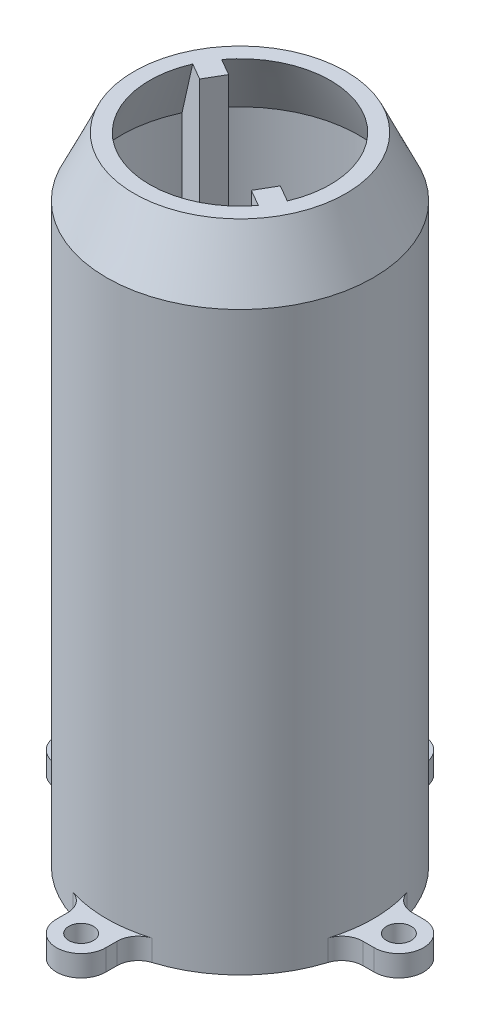
from build123d import *
from build123d.topology import SkipClean

# Parameters (mm, degrees)
SKETCH2_R           = 1.75
CUT_EXTRUDE1_DEPTH  = 10
SKETCH4_R           = 36.837485066
SKETCH4_R_2         = 31.9
CUT_EXTRUDE2_DEPTH  = 99.001122443
FILLET1_R           = 3
BOSS_EXTRUDE1_REACH = 99.221


with BuildPart() as part:
    # Sketch1 → Revolve1 (revolve)
    with BuildSketch(Plane(origin=(0, 0, 0), x_dir=(0, 0, -1), z_dir=(1, 0, 0)), mode=Mode.PRIVATE) as revolve1_sk:
        Polygon((-12.793244162, 90), (-15, 90), (-18.9, 81.63642301), (-18.9, 3), (-31.9, 3), (-31.9, 0), (-17.6, 0), (-16.9, 0), (-16.9, 81.193033685), align=None)
    revolve(revolve1_sk.sketch.rotate(Axis((0, -1110.96911415, 0), (0, 1, 0)), 180), axis=Axis((0, -1110.96911415, 0), (0, 1, 0)))

    # Sketch2 → Cut-Extrude1 (cut)
    with BuildSketch(Plane.XZ):
        with Locations(Location((0, 22.5, 0), (0, 0, 270))):
            Circle(SKETCH2_R)
        with Locations(Location((0, -22.5, 0), (0, 0, 270))):
            Circle(SKETCH2_R)
        with Locations(Location((-22.5, 0, 0), (0, 0, 270))):
            Circle(SKETCH2_R)
        with Locations(Location((22.5, 0, 0), (0, 0, 270))):
            Circle(SKETCH2_R)
    extrude(amount=-CUT_EXTRUDE1_DEPTH, mode=Mode.SUBTRACT)

    # Sketch4 → Cut-Extrude2 (cut, through all)
    # profile 1 of 2: a face of its own
    with SkipClean():  # the faces are left unmerged after this step: merging them gives an invalid solid
        with BuildSketch(Plane(origin=(0, 3, 0), x_dir=(1, 0, 0), z_dir=(0, 1, 0))):
            Circle(SKETCH4_R)
            Circle(SKETCH4_R_2, mode=Mode.SUBTRACT)
        # profile 2 of 2: a face of its own
        with BuildSketch(Plane(origin=(0, 3, 0), x_dir=(1, 0, 0), z_dir=(0, 1, 0))):
            Circle(SKETCH4_R_2)
            with BuildLine():
                Line((-3.5, 18.573098826), (-3.5, 22.5))
                ThreePointArc((-3.5, 22.5), (0, 26), (3.5, 22.5))
                Line((3.5, 22.5), (3.5, 18.573098826))
                ThreePointArc((3.5, 18.573098826), (13.364318164, 13.364318164), (18.573098826, 3.5))
                Line((18.573098826, 3.5), (22.5, 3.5))
                ThreePointArc((22.5, 3.5), (26, 0), (22.5, -3.5))
                Line((22.5, -3.5), (18.573098826, -3.5))
                ThreePointArc((18.573098826, -3.5), (13.364318164, -13.364318164), (3.5, -18.573098826))
                Line((3.5, -18.573098826), (3.5, -22.5))
                ThreePointArc((3.5, -22.5), (0, -26), (-3.5, -22.5))
                Line((-3.5, -22.5), (-3.5, -18.573098826))
                ThreePointArc((-3.5, -18.573098826), (-13.364318164, -13.364318164), (-18.573098826, -3.5))
                Line((-18.573098826, -3.5), (-22.5, -3.5))
                ThreePointArc((-22.5, -3.5), (-26, 0), (-22.5, 3.5))
                Line((-22.5, 3.5), (-18.573098826, 3.5))
                ThreePointArc((-18.573098826, 3.5), (-13.364318164, 13.364318164), (-3.5, 18.573098826))
            make_face(mode=Mode.SUBTRACT)
        extrude(amount=-CUT_EXTRUDE2_DEPTH, mode=Mode.SUBTRACT)

    # Fillet1
    # the kernel refuses this fillet: 3 mm, written as the material it adds along each edge
    with BuildSketch(Plane(origin=(-3.5, 3, -18.573098826), x_dir=(-0.9704272072576611, 0, 0.24139394237241404), z_dir=(0, -1, 0)), Plane(origin=(-18.573098826, 3, 3.5), x_dir=(0.24139394237237982, -3.328806956187132e-15, 0.9704272072576697), z_dir=(0, -1, 0)), Plane(origin=(3.5, 3, 18.573098826), x_dir=(0.970427207257667, 0, -0.24139394237239048), z_dir=(0, -1, 0)), Plane(origin=(18.573098826, 3, -3.5), x_dir=(-0.24139394237243622, 3.3288069561870833e-15, -0.9704272072576556), z_dir=(0, -1, 0))) as fillet1_piece_1:
        with BuildLine():
            CenterArc((2.346406537, 2.995034797), FILLET1_R, 193.968826574, 72.734276137)
            Line((-0.564875085, 2.27085297), (0, 0))
            ThreePointArc((0, 0), (1.086938322, 0.031280778), (2.173876645, 0))
        make_face()
    extrude(amount=3)
    with BuildSketch(Plane(origin=(-18.573098826, 3, -3.5), x_dir=(0.24139394237239928, 3.3288069561871153e-15, -0.9704272072576648), z_dir=(0, -1, 0)), Plane(origin=(-3.5, 3, 18.573098826), x_dir=(-0.9704272072576595, 0, -0.24139394237242057), z_dir=(0, -1, 0)), Plane(origin=(18.573098826, 3, 3.5), x_dir=(-0.24139394237244305, -3.328806956187078e-15, 0.970427207257654), z_dir=(0, -1, 0)), Plane(origin=(3.5, 3, -18.573098826), x_dir=(0.9704272072576657, 0, 0.2413939423723955), z_dir=(0, -1, 0))) as fillet1_piece_2:
        with BuildLine():
            CenterArc((2.346406537, -2.995034797), FILLET1_R, 93.296897289, 72.734276137)
            Line((-0.564875085, -2.27085297), (0, 0))
            ThreePointArc((0, 0), (1.086938322, -0.031280778), (2.173876645, 0))
        make_face()
    extrude(amount=3)

    # Boss-Extrude1: up to this cone (the profile starts inside it)
    boss_extrude1_end = Plane(origin=(0, 0, 0), z_dir=(0, -1, 0)).offset(-117.435199641) * Cone(1e-06, 126.797041985, 271.917133037, align=(Align.CENTER, Align.CENTER, Align.MIN), mode=Mode.PRIVATE)
    # Sketch5 → Boss-Extrude1 (add, up to the surface)
    with BuildSketch(Plane.XZ, mode=Mode.PRIVATE) as boss_extrude1_sk1:
        Polygon((14.838457268, 10.299038106), (16.338457268, 7.700961894), (9.410254038, 3.700961894), (7.910254038, 6.299038106), align=None)
    boss_extrude1_tool1 = extrude(boss_extrude1_sk1.sketch, amount=-BOSS_EXTRUDE1_REACH, mode=Mode.PRIVATE) & boss_extrude1_end
    add(boss_extrude1_tool1.solids().sort_by_distance((12.124356, 0, 7))[0])
    # Sketch5 → Boss-Extrude1 (add, up to the surface)
    with BuildSketch(Plane.XZ, mode=Mode.PRIVATE) as boss_extrude1_sk2:
        Polygon((-14.838457268, -10.299038106), (-16.338457268, -7.700961894), (-9.410254038, -3.700961894), (-7.910254038, -6.299038106), align=None)
    boss_extrude1_tool2 = extrude(boss_extrude1_sk2.sketch, amount=-BOSS_EXTRUDE1_REACH, mode=Mode.PRIVATE) & boss_extrude1_end
    add(boss_extrude1_tool2.solids().sort_by_distance((-12.124356, 0, -7))[0])

    # SurfaceCut2
    split(bisect_by=Plane(origin=(0, 90, 0), x_dir=(1, 0, 0), z_dir=(0, 1, 0)), keep=Keep.BOTTOM)


solid = part.part
